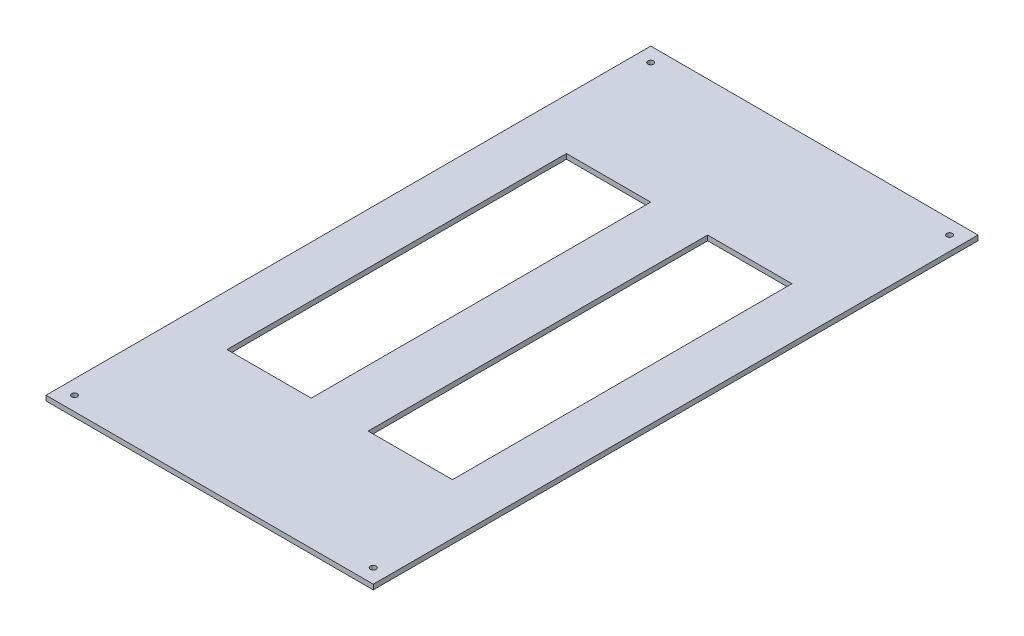
from build123d import *

# Parameters (mm, degrees)
SKETCH1_W                = 230
SKETCH1_H                = 425
BOSS_EXTRUDE1_DEPTH      = 3.5
F_4_0_4_DIAMETER_HOLE1_D = 4
SKETCH5_W                = 59.238451935
SKETCH5_H                = 238.6
CUT_EXTRUDE1_DEPTH       = 242.647470502


with BuildPart() as part:
    # Sketch1 → Boss-Extrude1 (new body)
    with BuildSketch(Plane(origin=(0, 0, 0), x_dir=(1, 0, 0), z_dir=(0, 1, 0))):
        Rectangle(SKETCH1_W, SKETCH1_H)
    extrude(amount=-BOSS_EXTRUDE1_DEPTH)

    # Ø4.0 (4) Diameter Hole1 (through all)
    with Locations(Plane(origin=(0, 0, 0), x_dir=(1, 0, 0), z_dir=(0, 1, 0))):
        with Locations((-105, 202.5), (105, 202.5), (105, -202.5), (-105, -202.5)):
            Hole(F_4_0_4_DIAMETER_HOLE1_D / 2)

    # Sketch5 → Cut-Extrude1 (cut, through all)
    with BuildSketch(Plane(origin=(0, 0, 0), x_dir=(1, 0, 0), z_dir=(0, 1, 0))):
        with Locations((-49.619225968, -1.8)):
            Rectangle(SKETCH5_W, SKETCH5_H)
        with Locations((49.619225968, -1.8)):
            Rectangle(SKETCH5_W, SKETCH5_H)
    extrude(amount=-CUT_EXTRUDE1_DEPTH, mode=Mode.SUBTRACT)


solid = part.part
